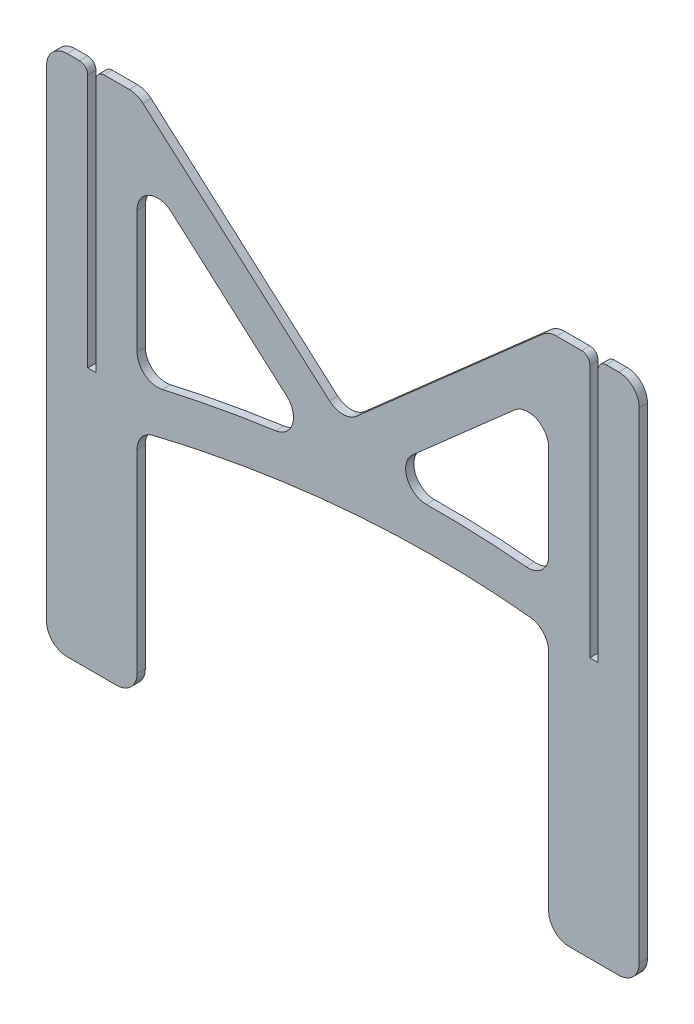
from build123d import *

# Parameters (mm, degrees)
BOSS_EXTRUDE1_DEPTH = 2
FILLET1_R           = 5
FILLET3_R           = 2
FILLET4_R           = 5


# Read off the part's stored shape, not the designer's step: Boss-Extrude1
with BuildPart() as part:
    # Boss-Extrude1 outline → Boss-Extrude1 (new body)
    with BuildSketch(Plane.XY):
        with BuildLine():
            add(Edge.make_bspline(
                [(50, 0.585067943), (46.302901229, 1.048620246), (37.443381796, 1.911582539), (24.310917963, 2.384537211), (13.949921349, 2.147279936), (6.881664213, 1.770872157), (3.157213928, 1.513128323), (-0.569629629, 1.197220359), (-4.294991328, 0.843416739), (-11.799290896, 0.01694185), (-23.43372993, -1.666844937), (-37.093919746, -4.304130089), (-46.054304433, -6.407794893), (-49.999999999, -7.403419123)],
                knots=[0.392731, 0.392731, 0.392731, 0.392731, 0.4375, 0.5, 0.551677708, 0.562945669, 0.585481591, 0.596749552, 0.608017513, 0.630553434, 0.6875, 0.75, 0.799585435, 0.799585435, 0.799585435, 0.799585435], degree=3))
            Line((50, 0.585067943), (50, -63.46310087))
            Line((50, -63.46310087), (72, -63.46310087))
            Line((72, -63.46310087), (72, 63.46310087))
            Line((72, 63.46310087), (62, 63.46310087))
            Line((62, 63.46310087), (62, -0.17689913))
            Line((62, -0.17689913), (60, -0.17689913))
            Line((60, -0.17689913), (60, 63.46310087))
            Line((60, 63.46310087), (50, 63.46310087))
            Line((50, 63.46310087), (0, 19.391503044))
            Line((0, 19.391503044), (-50, 63.46310087))
            Line((-50, 63.46310087), (-60, 63.46310087))
            Line((-60, 63.46310087), (-60, -0.17689913))
            Line((-60, -0.17689913), (-62, -0.17689913))
            Line((-62, -0.17689913), (-62, 63.46310087))
            Line((-62, 63.46310087), (-72, 63.46310087))
            Line((-72, 63.46310087), (-72, -63.46310087))
            Line((-72, -63.46310087), (-50, -63.46310087))
            Line((-50, -63.46310087), (-49.999999999, -7.403419123))
        make_face()
        with BuildLine():
            add(Edge.make_bspline(
                [(-5.349354195, 10.7764699), (-6.473284635, 10.660224491), (-12.934279192, 9.954218876), (-24.646320739, 8.284783337), (-38.353198567, 5.637906199), (-46.754684535, 3.697054478), (-49.999999999, 2.901338723)],
                knots=[0.611854507, 0.611854507, 0.611854507, 0.611854507, 0.625, 0.6875, 0.75, 0.789622747, 0.789622747, 0.789622747, 0.789622747], degree=3))
            Line((-49.999999999, 2.901338723), (-50, 50.132975987))
            Line((-50, 50.132975987), (-5.349354195, 10.7764699))
        make_face(mode=Mode.SUBTRACT)
        with BuildLine():
            Line((50, 50.132975987), (50, 10.659702462))
            add(Edge.make_bspline(
                [(50, 10.659702462), (46.536536843, 11.073334631), (37.671385716, 11.912189244), (23.444000892, 12.423604272), (12.413305008, 12.108752618), (6.751894701, 11.770134287), (6.456063808, 11.751959115)],
                knots=[0.397516142, 0.397516142, 0.397516142, 0.397516142, 0.4375, 0.5, 0.5625, 0.565946061, 0.565946061, 0.565946061, 0.565946061], degree=3))
            Line((6.456063808, 11.751959115), (50, 50.132975987))
        make_face(mode=Mode.SUBTRACT)
    extrude(amount=BOSS_EXTRUDE1_DEPTH)

    # Fillet1
    fillet1_edges = [part.edges().sort_by_distance(p)[0] for p in [
        (-72, -63.46310087, 1),
        (-72, 63.46310087, 1),
        (-50, 63.46310087, 1),
        (50, 63.46310087, 1),
        (72, 63.46310087, 1),
        (50, 0.585067943, 1),
        (72, -63.46310087, 1),
        (50, -63.46310087, 1),
        (-50, -63.46310087, 1),
        (-49.999999999, -7.403419123, 1),
        (0, 19.391503044, 1),
    ]]
    fillet(fillet1_edges, radius=FILLET1_R)

    # Fillet3
    fillet3_edges = [part.edges().sort_by_distance(p)[0] for p in [
        (-62, 63.46310087, 1),
        (-60, 63.46310087, 1),
        (60, 63.46310087, 1),
        (62, 63.46310087, 1),
    ]]
    fillet(fillet3_edges, radius=FILLET3_R)

    # Fillet4
    fillet4_edges = [part.edges().sort_by_distance(p)[0] for p in [
        (50, 50.132975987, 1),
        (6.456063808, 11.751959115, 1),
        (50, 10.659702462, 1),
        (-50, 50.132975987, 1),
        (-49.999999999, 2.901338723, 1),
        (-5.349354195, 10.7764699, 1),
    ]]
    fillet(fillet4_edges, radius=FILLET4_R)


solid = part.part
